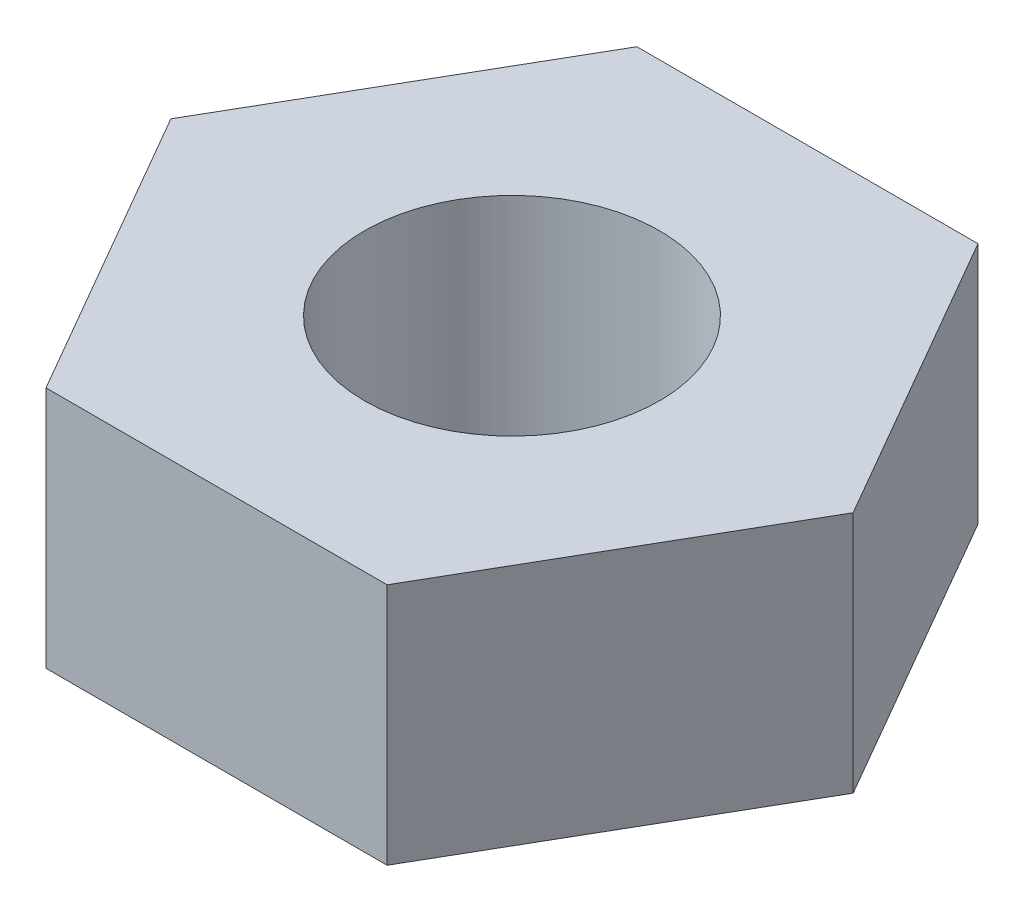
from build123d import *

# Parameters (mm, degrees)
BOSS_EXTRUDE1_DEPTH = 4.53
SKETCH2_R           = 2.75
CUT_EXTRUDE1_DEPTH  = 16.265700115


with BuildPart() as part:
    # Sketch1 → Boss-Extrude1 (new body)
    with BuildSketch(Plane(origin=(0, 0, 0), x_dir=(1, 0, 0), z_dir=(0, 1, 0))):
        Polygon((0, 0), (6.362399966, 0), (9.54359995, 5.51), (6.362399966, 11.02), (0, 11.02), (-3.181199983, 5.51), align=None)
    extrude(amount=BOSS_EXTRUDE1_DEPTH)

    # Sketch2 → Cut-Extrude1 (cut, through all)
    with BuildSketch(Plane(origin=(0, 4.53, 0), x_dir=(1, 0, 0), z_dir=(0, 1, 0))):
        with Locations((3.181199983, 5.51)):
            Circle(SKETCH2_R)
    extrude(amount=-CUT_EXTRUDE1_DEPTH, mode=Mode.SUBTRACT)


solid = part.part
